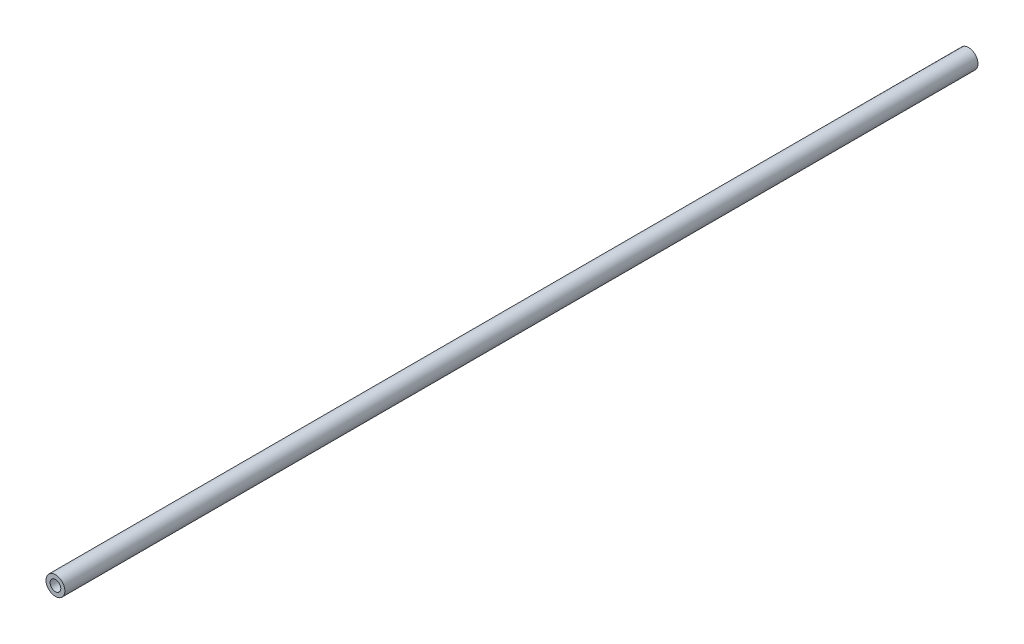
from build123d import *

# Parameters (mm, degrees)
SKETCH1_R           = 6
SKETCH1_R_2         = 3.4
BOSS_EXTRUDE1_DEPTH = 580


with BuildPart() as part:
    # Sketch1 → Boss-Extrude1 (new body)
    with BuildSketch(Plane.XY):
        Circle(SKETCH1_R)
        Circle(SKETCH1_R_2, mode=Mode.SUBTRACT)
    extrude(amount=BOSS_EXTRUDE1_DEPTH)


solid = part.part
